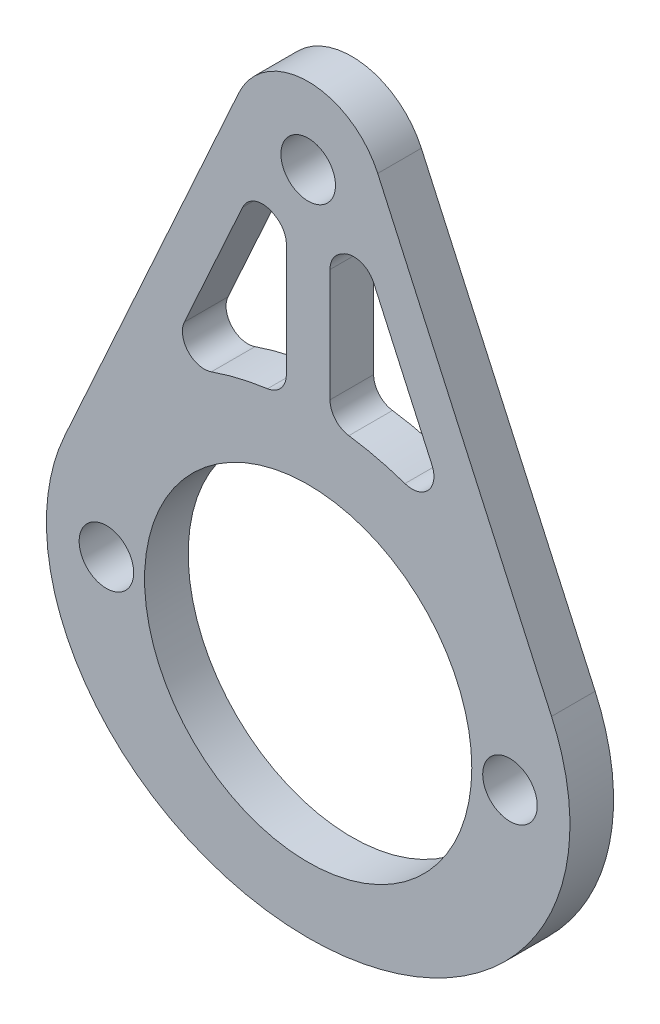
from build123d import *

# Parameters (mm, degrees)
SKETCH_1_R          = 7.5
SKETCH_1_R_2        = 1
EXTRUDE_1_DEPTH     = 2
HOLE_WIZARD_M3_1_D  = 2.5
CUT_EXTRUDE_1_DEPTH = 27.462237387
FILLET_1_R          = 1
HOLE_WIZARD_M3_2_D  = 2.5


with BuildPart() as part:
    # ｽｹｯﾁ1 → ﾎﾞｽ - 押し出し1 (new body)
    with BuildSketch(Plane.XY):
        with BuildLine():
            Line((-11.154481221, 3.871570833), (-3.187731553, 21.445118523))
            ThreePointArc((-3.187731553, 21.445118523), (0, 23.5), (3.187731553, 21.445118523))
            Line((3.187731553, 21.445118523), (11.154481221, 3.871570833))
            add(Edge.make_bspline(
                [(-11.154481221, 3.871570833), (-17.669654434, -10.5), (0, -10.5), (17.669654434, -10.5), (11.154481221, 3.871570833)],
                knots=[2.763959924, 2.763959924, 2.763959924, 4.71238898, 4.71238898, 6.660818037, 6.660818037, 6.660818037], degree=2, weights=[1, 0.561818017, 1, 0.561818017, 1]))
        make_face()
        Circle(SKETCH_1_R, mode=Mode.SUBTRACT)
        with Locations((9.25, 0)):
            Circle(SKETCH_1_R_2, mode=Mode.SUBTRACT)
        with Locations((-9.25, 0)):
            Circle(SKETCH_1_R_2, mode=Mode.SUBTRACT)
    extrude(amount=EXTRUDE_1_DEPTH)

    # M3 ねじ穴1 (through all)
    with Locations(Plane(origin=(0, 0, 0), x_dir=(-1, 0, 0), z_dir=(0, 0, -1))):
        with Locations((-9.25, 0), (9.25, 0)):
            Hole(HOLE_WIZARD_M3_1_D / 2)

    # ｽｹｯﾁ4 → ｶｯﾄ - 押し出し1 (cut, through all)
    with BuildSketch(Plane(origin=(0, 0, 0), x_dir=(-1, 0, 0), z_dir=(0, 0, -1))):
        with BuildLine():
            Line((1, 17.171572875), (1, 10.46347815))
            add(Edge.make_bspline(
                [(6.788544403, 8.658330147), (4.16749896, 10.231708527), (1, 10.46347815)],
                knots=[4.057974114, 4.057974114, 4.057974114, 4.608984762, 4.608984762, 4.608984762], degree=2, weights=[0.75323278, 0.816994665, 0.948327675]))
            Line((6.788544403, 8.658330147), (2.438892968, 18.253059506))
            ThreePointArc((2.438892968, 18.253059506), (1.8024704, 17.601854788), (1, 17.171572875))
        make_face()
        with BuildLine():
            add(Edge.make_bspline(
                [(-1, 10.46347815), (-4.16749896, 10.231708527), (-6.788544403, 8.658330147)],
                knots=[4.815793199, 4.815793199, 4.815793199, 5.366803847, 5.366803847, 5.366803847], degree=2, weights=[0.948327675, 0.816994665, 0.75323278]))
            Line((-1, 10.46347815), (-1, 17.171572875))
            ThreePointArc((-1, 17.171572875), (-1.8024704, 17.601854788), (-2.438892968, 18.253059506))
            Line((-2.438892968, 18.253059506), (-6.788544403, 8.658330147))
        make_face()
    extrude(amount=-CUT_EXTRUDE_1_DEPTH, mode=Mode.SUBTRACT)

    # ﾌｨﾚｯﾄ1
    fillet_1_edges = [part.edges().sort_by_distance(p)[0] for p in [
        (-1, 17.171572875, 1),
        (-2.438892968, 18.253059506, 1),
        (-6.788544403, 8.658330147, 1),
        (2.438892968, 18.253059506, 1),
        (1, 17.171572875, 1),
        (1, 10.46347815, 1),
        (6.788544403, 8.658330147, 1),
        (-1, 10.46347815, 1),
    ]]
    fillet(fillet_1_edges, radius=FILLET_1_R)

    # M3 ねじ穴2 (through all)
    with Locations(Plane.XY.offset(2)):
        with Locations((0, 20)):
            Hole(HOLE_WIZARD_M3_2_D / 2)


solid = part.part
